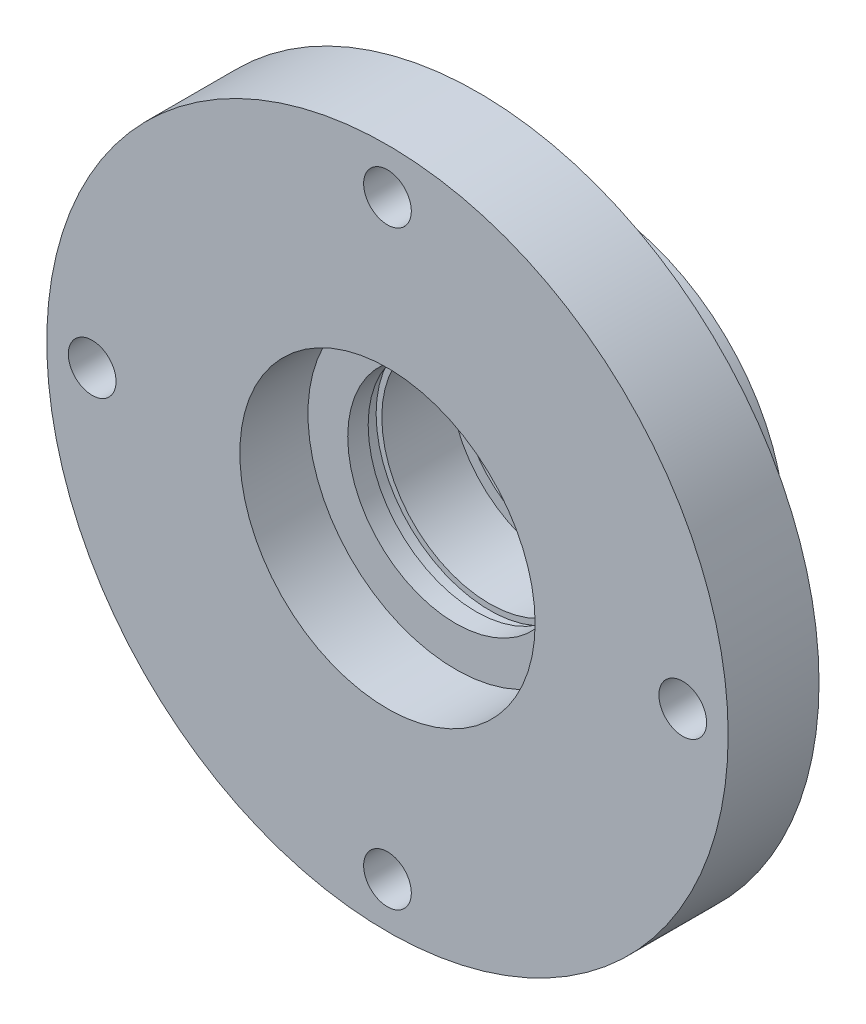
from build123d import *

# Parameters (mm, degrees)
SKETCH1_R                  = 17
SKETCH1_R_2                = 13
BOSS_EXTRUDE1_DEPTH        = 10
SKETCH2_R                  = 30
SKETCH2_R_2                = 13
BOSS_EXTRUDE2_DEPTH        = 8
SKETCH6_R                  = 17
SKETCH6_R_2                = 8.5
BOSS_EXTRUDE3_DEPTH        = 3
SKETCH7_R                  = 13
SKETCH7_R_2                = 9.5
BOSS_EXTRUDE4_DEPTH        = 9
CUT_EXTRUDE2_START         = -1.8
SKETCH8_R                  = 10
CUT_EXTRUDE2_DEPTH         = 1.2
F_4_2_4_2_DIAMETER_HOLE2_D = 4.2


with BuildPart() as part:
    # Sketch1 → Boss-Extrude1 (new body)
    with BuildSketch(Plane.XY):
        Circle(SKETCH1_R)
        Circle(SKETCH1_R_2, mode=Mode.SUBTRACT)
    extrude(amount=BOSS_EXTRUDE1_DEPTH)

    # Sketch2 → Boss-Extrude2 (add)
    with BuildSketch(Plane.XY.offset(10)):
        Circle(SKETCH2_R)
        Circle(SKETCH2_R_2, mode=Mode.SUBTRACT)
    extrude(amount=BOSS_EXTRUDE2_DEPTH)

    # Sketch6 → Boss-Extrude3 (add)
    with BuildSketch(Plane(origin=(0, 0, 0), x_dir=(-1, 0, 0), z_dir=(0, 0, -1))):
        Circle(SKETCH6_R)
        Circle(SKETCH6_R_2, mode=Mode.SUBTRACT)
    extrude(amount=-BOSS_EXTRUDE3_DEPTH)

    # Sketch7 → Boss-Extrude4 (add)
    with BuildSketch(Plane.XY.offset(3)):
        Circle(SKETCH7_R)
        Circle(SKETCH7_R_2, mode=Mode.SUBTRACT)
    extrude(amount=BOSS_EXTRUDE4_DEPTH)

    # Sketch8 → Cut-Extrude2 (cut)
    with BuildSketch(Plane.XY.offset(12).offset(CUT_EXTRUDE2_START)):
        Circle(SKETCH8_R)
    extrude(amount=-CUT_EXTRUDE2_DEPTH, mode=Mode.SUBTRACT)

    # Ø4.2 (4.2) Diameter Hole2 (through all)
    with Locations(Plane.XY.offset(18)):
        with Locations((-26, 0), (0, 26), (26, 0), (0, -26)):
            Hole(F_4_2_4_2_DIAMETER_HOLE2_D / 2)


solid = part.part
